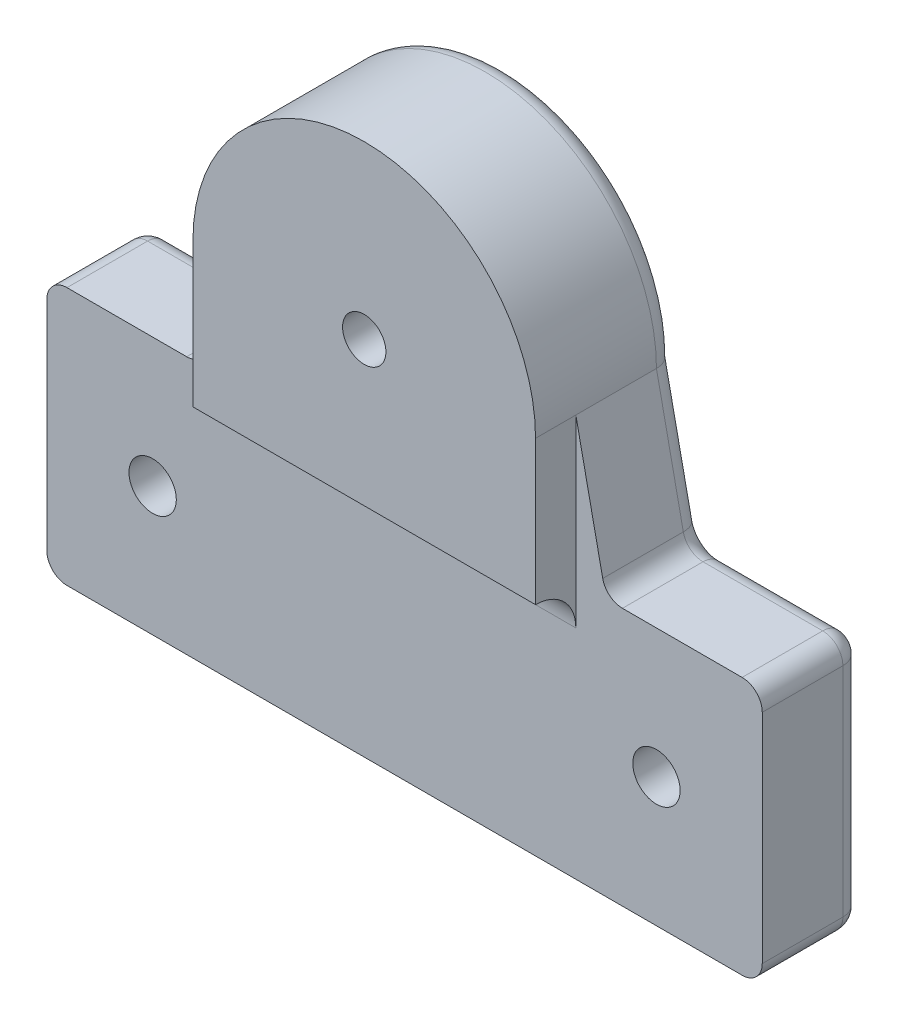
from build123d import *

# Parameters (mm, degrees)
SKETCH1_W           = 71
SKETCH1_H           = 25.6
BOSS_EXTRUDE1_DEPTH = 10
BOSS_EXTRUDE2_DEPTH = 14
FILLET1_R           = 4
CHAMFER1_START      = -22.201998907
CHAMFER1_OUTLINE_W  = 14.611297
CHAMFER1_OUTLINE_H  = 10
CHAMFER1_DEPTH      = 3.757366646
CHAMFER2_START      = 18.444632261
CHAMFER2_OUTLINE_W  = 14.611297
CHAMFER2_OUTLINE_H  = 10
CHAMFER2_DEPTH      = 3.757366646
FILLET3_R           = 2
SKETCH5_R           = 2.35
CUT_EXTRUDE1_DEPTH  = 14
FILLET4_R           = 2
SKETCH6_R           = 2.15
CUT_EXTRUDE2_DEPTH  = 13


with BuildPart() as part:
    # Sketch1 → Boss-Extrude1 (new body)
    with BuildSketch(Plane.XY):
        Rectangle(SKETCH1_W, SKETCH1_H)
    extrude(amount=BOSS_EXTRUDE1_DEPTH)

    # Sketch3 → Boss-Extrude2 (add)
    with BuildSketch(Plane.XY):
        with BuildLine():
            Line((-17, 12.8), (17, 12.8))
            Line((17, 12.8), (17, 27.1))
            ThreePointArc((17, 27.1), (0, 44.1), (-17, 27.1))
            Line((-17, 27.1), (-17, 12.8))
        make_face()
    extrude(amount=BOSS_EXTRUDE2_DEPTH)

    # Fillet1
    fillet1_edges = [part.edges().sort_by_distance(p)[0] for p in [
        (0, 12.8, 10),
    ]]
    fillet(fillet1_edges, radius=FILLET1_R - 0.0001)  # a hair under: the kernel refuses the full size

    # Chamfer1: read off the stored shape, not the designer's step
    # Chamfer1 outline → Chamfer1 (add)
    with BuildSketch(Plane(origin=(0, 0, 0), x_dir=(0.2053205817495901, 0.9786947730063801, 0), z_dir=(0.9786947730063802, -0.20532058174959006, 0)).offset(CHAMFER1_START)):
        with Locations((15.726529959, 5)):
            Rectangle(CHAMFER1_OUTLINE_W, CHAMFER1_OUTLINE_H)
    extrude(amount=CHAMFER1_DEPTH)

    # Chamfer2: read off the stored shape, not the designer's step
    # Chamfer2 outline → Chamfer2 (add)
    with BuildSketch(Plane(origin=(0, 0, 0), x_dir=(-0.2053205817495901, 0.9786947730063801, 0), z_dir=(0.9786947730063802, 0.20532058174959006, 0)).offset(CHAMFER2_START)):
        with Locations((15.726529959, 5)):
            Rectangle(CHAMFER2_OUTLINE_W, CHAMFER2_OUTLINE_H)
    extrude(amount=CHAMFER2_DEPTH)

    # Fillet3
    fillet3_edges = [part.edges().sort_by_distance(p)[0] for p in [
        (-20.000000001, 12.8, 5),
        (20.000000001, 12.8, 5),
        (35.5, -12.8, 5),
        (-35.5, -12.8, 5),
        (-35.5, 12.8, 5),
        (35.5, 12.8, 5),
    ]]
    fillet(fillet3_edges, radius=FILLET3_R)

    # Sketch5 → Cut-Extrude1 (cut)
    with BuildSketch(Plane.XY.offset(10)):
        with Locations((-25, 0)):
            Circle(SKETCH5_R)
        with Locations(Location((25, 0, 0), (0, 0, 180))):
            Circle(SKETCH5_R)
    extrude(amount=-CUT_EXTRUDE1_DEPTH, mode=Mode.SUBTRACT)

    # Fillet4
    fillet4_edges = [part.edges().sort_by_distance(p)[0] for p in [
        (-27.35, 0, 0),
        (27.35, 0, 0),
        (0, 44.1, 0),
        (-18.333284039, 20.744679418, 0),
        (27.561978811, 12.8, 0),
        (35.5, 0, 0),
        (0, -12.8, 0),
        (-35.5, 0, 0),
        (-27.561978811, 12.8, 0),
        (18.333284039, 20.744679418, 0),
        (-34.914213562, 12.214213562, 0),
        (-34.914213562, -12.214213562, 0),
        (34.914213562, -12.214213562, 0),
        (34.914213562, 12.214213562, 0),
        (-20.363259865, 13.247376039, 0),
        (20.363259865, 13.247376039, 0),
    ]]
    fillet(fillet4_edges, radius=FILLET4_R)

    # Sketch6 → Cut-Extrude2 (cut)
    with BuildSketch(Plane.XY.offset(14)):
        with Locations((0, 27.1)):
            Circle(SKETCH6_R)
    extrude(amount=-CUT_EXTRUDE2_DEPTH, mode=Mode.SUBTRACT)


solid = part.part
